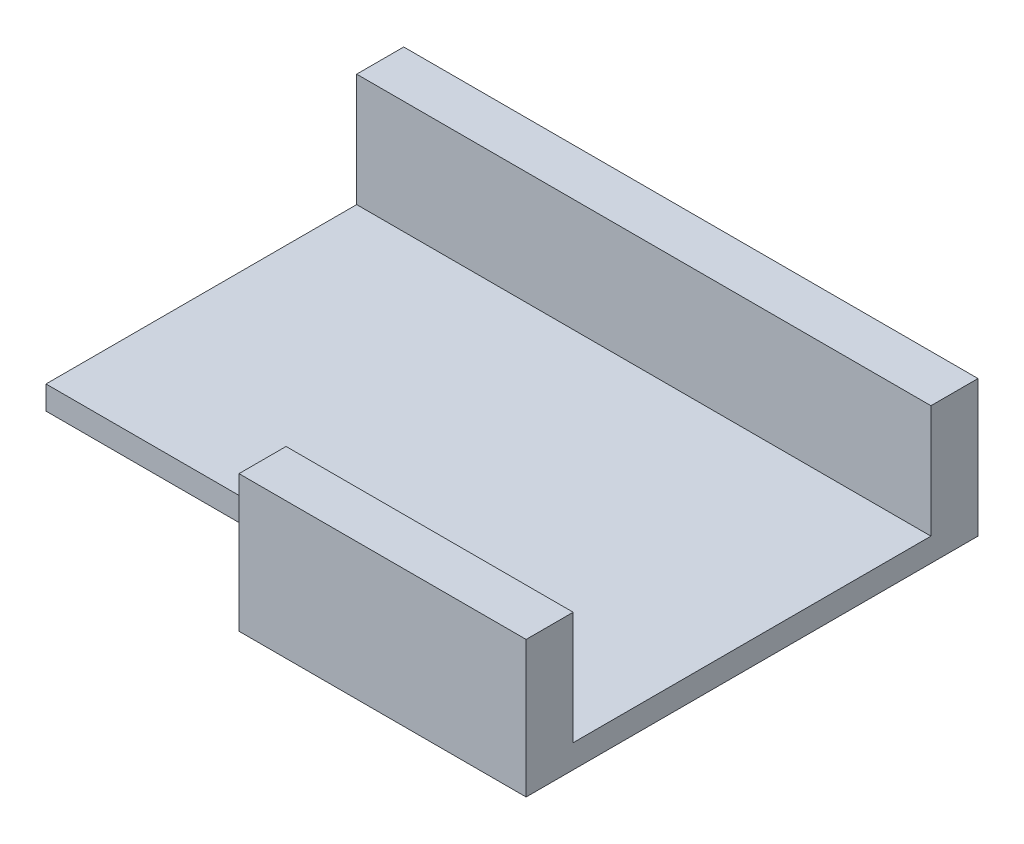
from build123d import *

# Parameters (mm, degrees)
BOSS_EXTRUDE1_DEPTH = 2.5
SKETCH2_W           = 61
SKETCH2_H           = 5
SKETCH2_W_2         = 30.5
BOSS_EXTRUDE2_DEPTH = 12
CUT_EXTRUDE1_DEPTH  = 1


with BuildPart() as part:
    # Sketch1 → Boss-Extrude1 (new body)
    with BuildSketch(Plane(origin=(0, 0, 0), x_dir=(1, 0, 0), z_dir=(0, 1, 0))):
        Polygon((0, 10), (30.5, 10), (30.5, 0), (61, 0), (61, 48), (0, 48), align=None)
    extrude(amount=BOSS_EXTRUDE1_DEPTH)

    # Sketch2 → Boss-Extrude2 (add)
    with BuildSketch(Plane(origin=(0, 2.5, 0), x_dir=(1, 0, 0), z_dir=(0, 1, 0))):
        with Locations((30.5, 45.5)):
            Rectangle(SKETCH2_W, SKETCH2_H)
        with Locations((45.75, 2.5)):
            Rectangle(SKETCH2_W_2, SKETCH2_H)
    extrude(amount=BOSS_EXTRUDE2_DEPTH)

    # Sketch3 → Cut-Extrude1 (cut)
    # profile 1 of 3: a face of its own
    with BuildSketch(Plane.XZ):
        with BuildLine():
            Line((33.86328125, -25.3125), (34.48125, -25.3125))
            Line((34.48125, -25.3125), (34.48125, -24.368457031))
            add(Edge.make_bspline(
                [(34.48125, -24.368457031), (34.48239424, -24.336474597), (34.484546237, -24.276324517), (34.501338872, -24.191750417), (34.530467184, -24.119462511), (34.571596484, -24.060118613), (34.6213594, -24.013525282), (34.678121744, -23.980203479), (34.74130099, -23.960090646), (34.785300335, -23.957557383), (34.808007812, -23.95625)],
                knots=[0, 0, 0, 0, 1.295934932, 2.437293871, 3.476884157, 4.432697822, 5.341229782, 6.218948562, 7.080823006, 8, 8, 8, 8], degree=3))
            add(Edge.make_bspline(
                [(34.808007812, -23.95625), (34.8316052, -23.95759305), (34.877349561, -23.9601966), (34.942644764, -23.979576761), (35.000045694, -24.013396419), (35.049241996, -24.060167447), (35.089336549, -24.11922265), (35.118192016, -24.190865316), (35.134945088, -24.27449113), (35.136617117, -24.334196437), (35.1375, -24.365722656)],
                knots=[0, 0, 0, 0, 0.953503961, 1.84840077, 2.723875908, 3.623362083, 4.571508737, 5.587892323, 6.726333698, 8, 8, 8, 8], degree=3))
            Line((35.1375, -24.365722656), (35.1375, -26.952441406))
            add(Edge.make_bspline(
                [(35.1375, -26.952441406), (35.137309541, -26.970453538), (35.136942339, -27.005180782), (35.132109907, -27.05547116), (35.123988289, -27.101610656), (35.113173049, -27.144056975), (35.09877644, -27.182238074), (35.081834065, -27.216903852), (35.061176018, -27.247343286), (35.028696375, -27.282553112), (34.977342302, -27.318587605), (34.90253473, -27.348308313), (34.813122341, -27.365734265), (34.748847605, -27.367696821), (34.714355469, -27.36875)],
                knots=[0, 0, 0, 0, 0.941432114, 1.815073475, 2.637677653, 3.388955501, 4.101451217, 4.767410686, 5.401829277, 6.017285369, 7.263665478, 8.641928091, 10.197937795, 12, 12, 12, 12], degree=3))
            Line((34.714355469, -27.36875), (33.857128906, -27.36875))
            add(Edge.make_bspline(
                [(33.857128906, -27.36875), (33.826361754, -27.368765475), (33.766629061, -27.368795519), (33.679818936, -27.364836196), (33.598400099, -27.360544309), (33.522550046, -27.353342107), (33.451939103, -27.345835288), (33.387096157, -27.334392967), (33.3273701, -27.322705191), (33.289918952, -27.312240947), (33.271972656, -27.307226563)],
                knots=[0, 0, 0, 0, 1.25093483, 2.428619552, 3.533171233, 4.56585484, 5.526700924, 6.419361569, 7.242570462, 8, 8, 8, 8], degree=3))
            add(Edge.make_bspline(
                [(33.271972656, -27.307226563), (33.237951469, -27.296865789), (33.171024079, -27.276483796), (33.076914962, -27.232416707), (32.989275965, -27.18045676), (32.909134146, -27.118770913), (32.837200637, -27.048384605), (32.774807455, -26.969771375), (32.720851198, -26.884199515), (32.676366012, -26.79113524), (32.64250918, -26.690930503), (32.617939843, -26.584937391), (32.60239908, -26.473018359), (32.600811741, -26.396276061), (32.6, -26.35703125)],
                knots=[0, 0, 0, 0, 1.01587007, 1.998446821, 2.962857435, 3.924711095, 4.883137489, 5.833623106, 6.788187457, 7.770396829, 8.775995668, 9.806534978, 10.878296272, 12, 12, 12, 12], degree=3))
            add(Edge.make_bspline(
                [(32.6, -26.35703125), (32.600791799, -26.315506736), (32.602333117, -26.234674931), (32.617942425, -26.117336922), (32.641867405, -26.007400691), (32.677187754, -25.905532425), (32.721346607, -25.811053934), (32.776760451, -25.725041415), (32.841427224, -25.646296575), (32.916403464, -25.575701504), (33.001275199, -25.513035101), (33.096032569, -25.458911664), (33.200911882, -25.41419895), (33.314623829, -25.376215077), (33.438393876, -25.348264044), (33.57121392, -25.326836823), (33.714032561, -25.314722174), (33.812445199, -25.313256902), (33.86328125, -25.3125)],
                knots=[0, 0, 0, 0, 1.064099757, 2.071381358, 3.029532051, 3.944102834, 4.830028396, 5.697085954, 6.560336241, 7.436498814, 8.330402393, 9.259414661, 10.22755928, 11.249241442, 12.329118529, 13.476919915, 14.696677257, 16, 16, 16, 16], degree=3))
        make_face()
        with BuildLine():
            Line((34.026660156, -26.84375), (34.48125, -26.84375))
            Line((34.48125, -26.84375), (34.48125, -25.8375))
            Line((34.48125, -25.8375), (34.026660156, -25.8375))
            add(Edge.make_bspline(
                [(34.026660156, -25.8375), (33.988592541, -25.838237268), (33.915538617, -25.839652128), (33.81060953, -25.848082671), (33.71549599, -25.863665996), (33.629922403, -25.885202249), (33.553847729, -25.913659606), (33.487054747, -25.950165269), (33.429663459, -25.994661369), (33.382279686, -26.047723655), (33.34445944, -26.108769705), (33.318824349, -26.179264403), (33.302885742, -26.258110004), (33.300990332, -26.313654404), (33.3, -26.342675781)],
                knots=[0, 0, 0, 0, 1.355490531, 2.601263584, 3.744314843, 4.783295291, 5.73857318, 6.628241228, 7.483545512, 8.310919991, 9.148572807, 10.024070886, 10.967597354, 12, 12, 12, 12], degree=3))
            add(Edge.make_bspline(
                [(33.3, -26.342675781), (33.301471852, -26.377478655), (33.304308668, -26.444556967), (33.3290638, -26.540041113), (33.368791809, -26.626502831), (33.409112888, -26.673866349), (33.429199219, -26.697460938)],
                knots=[0, 0, 0, 0, 1.078100798, 2.07790835, 3.042491687, 4, 4, 4, 4], degree=3))
            add(Edge.make_bspline(
                [(33.429199219, -26.697460938), (33.442509491, -26.70933628), (33.470638515, -26.734432821), (33.522606761, -26.763805357), (33.583688523, -26.788247214), (33.653818972, -26.808474028), (33.733550852, -26.82486366), (33.822913711, -26.835983762), (33.921732586, -26.842879876), (33.990644933, -26.84345134), (34.026660156, -26.84375)],
                knots=[0, 0, 0, 0, 0.679605585, 1.436232247, 2.263557416, 3.188698774, 4.219445133, 5.368894214, 6.624921853, 8, 8, 8, 8], degree=3))
        make_face(mode=Mode.SUBTRACT)
    # profile 2 of 3: a face of its own
    with BuildSketch(Plane.XZ):
        with BuildLine():
            add(Edge.make_bspline(
                [(29.141699219, -25.072558594), (29.142627548, -25.045377271), (29.144544291, -24.989255328), (29.160670802, -24.90388712), (29.185350326, -24.815056444), (29.220514712, -24.72384793), (29.264937159, -24.630532028), (29.323530716, -24.539258737), (29.391376403, -24.447534585), (29.470933455, -24.357832979), (29.562161785, -24.272156868), (29.666223271, -24.194806178), (29.78159185, -24.125611324), (29.908424046, -24.065365503), (30.046627258, -24.015600369), (30.196962897, -23.981434929), (30.357857993, -23.959697787), (30.468936671, -23.957419778), (30.525976562, -23.95625)],
                knots=[0, 0, 0, 0, 0.663809421, 1.370583582, 2.116381689, 2.914792191, 3.756591336, 4.637276302, 5.560556971, 6.542796295, 7.563249714, 8.61348911, 9.705063432, 10.845866508, 12.040043321, 13.286776638, 14.606735603, 16, 16, 16, 16], degree=3))
            add(Edge.make_bspline(
                [(30.525976562, -23.95625), (30.56952206, -23.956607885), (30.654674631, -23.957307723), (30.77941016, -23.96766795), (30.898262463, -23.981815887), (31.011191593, -24.004152866), (31.118552239, -24.03200962), (31.221180036, -24.066016617), (31.318446263, -24.107945169), (31.411113288, -24.156806069), (31.500320124, -24.212305732), (31.584677459, -24.276934617), (31.666369128, -24.348844824), (31.716113809, -24.402632424), (31.74140625, -24.429980469)],
                knots=[0, 0, 0, 0, 1.162630074, 2.273505771, 3.340854002, 4.357736274, 5.345239217, 6.30170676, 7.242243125, 8.17051209, 9.097503438, 10.04445617, 11.005713226, 12, 12, 12, 12], degree=3))
            add(Edge.make_bspline(
                [(31.74140625, -24.429980469), (31.763382854, -24.457299605), (31.807431964, -24.512057093), (31.867906767, -24.599273348), (31.922446365, -24.691828691), (31.971995014, -24.788799108), (32.017641672, -24.889292284), (32.05620932, -24.993814225), (32.08943495, -25.101688094), (32.115589681, -25.213022396), (32.137211634, -25.327687277), (32.15190493, -25.445718355), (32.161157304, -25.567330415), (32.162047851, -25.64949452), (32.1625, -25.691210937)],
                knots=[0, 0, 0, 0, 0.929585709, 1.863227982, 2.811461118, 3.776261533, 4.749952569, 5.736551839, 6.728594992, 7.741346452, 8.767706922, 9.821503149, 10.893932021, 12, 12, 12, 12], degree=3))
            add(Edge.make_bspline(
                [(32.1625, -25.691210937), (32.16115634, -25.758047093), (32.158534311, -25.888471667), (32.135218348, -26.078448129), (32.099087507, -26.258119476), (32.0461427, -26.42645083), (31.979788468, -26.583749333), (31.900253243, -26.729540045), (31.807554025, -26.863680201), (31.702143677, -26.985419612), (31.585625789, -27.094320397), (31.459427375, -27.190118375), (31.322982336, -27.270697352), (31.179013685, -27.33866888), (31.027654415, -27.391119315), (30.870852127, -27.428799727), (30.709190508, -27.451996642), (30.599652983, -27.454824458), (30.544433594, -27.45625)],
                knots=[0, 0, 0, 0, 1.192073534, 2.326221231, 3.409828448, 4.457827128, 5.468939524, 6.451447323, 7.415699984, 8.372639448, 9.31899229, 10.256535946, 11.193647551, 12.141230983, 13.092713807, 14.046270366, 15.015097733, 16, 16, 16, 16], degree=3))
            add(Edge.make_bspline(
                [(30.544433594, -27.45625), (30.510693283, -27.455700013), (30.444040937, -27.45461354), (30.345504951, -27.446728549), (30.249463222, -27.435105119), (30.156618408, -27.415853856), (30.066148785, -27.394045563), (29.978975009, -27.365331623), (29.894167976, -27.333082269), (29.812957056, -27.294473043), (29.735632383, -27.252263218), (29.662367864, -27.207841274), (29.593629776, -27.161435398), (29.529905508, -27.111883577), (29.470463566, -27.060391839), (29.416381542, -27.00580611), (29.365977019, -26.949946857), (29.321470352, -26.891168159), (29.281036181, -26.832352073), (29.246990884, -26.773061538), (29.217140932, -26.715133206), (29.193571885, -26.657549126), (29.17359739, -26.601470501), (29.161081685, -26.545646278), (29.152152393, -26.4908458), (29.151104172, -26.454364346), (29.150585937, -26.436328125)],
                knots=[0, 0, 0, 0, 1.284668957, 2.537801117, 3.762584319, 4.965690975, 6.146308853, 7.304293802, 8.458044789, 9.599230559, 10.725239914, 11.81156767, 12.860878232, 13.881416145, 14.883791186, 15.853213571, 16.805831023, 17.746478395, 18.658598637, 19.521777503, 20.34832981, 21.137939278, 21.889792538, 22.611708679, 23.313636733, 24, 24, 24, 24], degree=3))
            add(Edge.make_bspline(
                [(29.150585937, -26.436328125), (29.151719751, -26.417322107), (29.153955539, -26.379843762), (29.169372498, -26.32523942), (29.1961356, -26.274678018), (29.231967064, -26.228837403), (29.275163443, -26.189734067), (29.324402295, -26.16151758), (29.377850323, -26.143019384), (29.415210838, -26.141240079), (29.434277344, -26.140332031)],
                knots=[0, 0, 0, 0, 1.004600132, 1.980990953, 2.972502221, 4.011199951, 5.043730753, 6.031501978, 6.995399868, 8, 8, 8, 8], degree=3))
            add(Edge.make_bspline(
                [(29.434277344, -26.140332031), (29.454841423, -26.14110154), (29.493828505, -26.142560439), (29.548388473, -26.153796071), (29.595128493, -26.17358594), (29.633810582, -26.203600073), (29.668281176, -26.243296222), (29.704172208, -26.292089523), (29.740853872, -26.353239882), (29.76509643, -26.39794629), (29.778125, -26.421972656)],
                knots=[0, 0, 0, 0, 1.036150269, 1.964419307, 2.792539992, 3.57139125, 4.409018128, 5.436022236, 6.622052788, 8, 8, 8, 8], degree=3))
            add(Edge.make_bspline(
                [(29.778125, -26.421972656), (29.800530009, -26.462360578), (29.843753765, -26.54027698), (29.91992911, -26.64489999), (30.002451951, -26.733177846), (30.090685173, -26.806898887), (30.188580799, -26.863538515), (30.296501945, -26.903256396), (30.41492428, -26.92659269), (30.497158871, -26.929663402), (30.539648437, -26.93125)],
                knots=[0, 0, 0, 0, 1.140605131, 2.200456059, 3.188445675, 4.120704386, 5.03149181, 5.968686328, 6.950446063, 8, 8, 8, 8], degree=3))
            add(Edge.make_bspline(
                [(30.539648437, -26.93125), (30.573895871, -26.930489449), (30.641176184, -26.92899532), (30.73900723, -26.912582011), (30.831767288, -26.887429724), (30.919066007, -26.851712223), (31.001074259, -26.805592879), (31.077443162, -26.748776405), (31.148877248, -26.682364452), (31.213781704, -26.605174132), (31.272474153, -26.519099316), (31.323877784, -26.424339484), (31.36727003, -26.320874794), (31.401444813, -26.208705273), (31.428995118, -26.088104374), (31.44853262, -25.959026101), (31.460119382, -25.821306412), (31.461692095, -25.726780675), (31.4625, -25.678222656)],
                knots=[0, 0, 0, 0, 0.936881308, 1.840536965, 2.707859603, 3.564070369, 4.416111086, 5.277127478, 6.16441668, 7.080712987, 8.03249564, 9.012429363, 10.027484651, 11.099028271, 12.21902665, 13.412014178, 14.670547665, 16, 16, 16, 16], degree=3))
            add(Edge.make_bspline(
                [(31.4625, -25.678222656), (31.461989548, -25.645407372), (31.460992931, -25.581338046), (31.456612284, -25.487095932), (31.447310234, -25.397327336), (31.436256789, -25.311415195), (31.420266484, -25.230034481), (31.401430504, -25.152814849), (31.378552673, -25.079869886), (31.353093411, -25.0109099), (31.322970649, -24.946606522), (31.292232911, -24.885471527), (31.25702381, -24.82912788), (31.218868448, -24.77742969), (31.178066839, -24.729594052), (31.134632471, -24.685902225), (31.087776748, -24.646801226), (31.022060624, -24.600199179), (30.933007852, -24.55215441), (30.817353592, -24.510859906), (30.692949763, -24.48562254), (30.606989242, -24.482732579), (30.562890625, -24.48125)],
                knots=[0, 0, 0, 0, 1.161534802, 2.267807614, 3.337466882, 4.354804688, 5.332236354, 6.271079903, 7.1663807, 8.036633147, 8.870242868, 9.678179816, 10.456933165, 11.218245902, 11.950381986, 12.680293945, 13.395853249, 14.107402253, 15.529151474, 16.960201914, 18.440552847, 20, 20, 20, 20], degree=3))
            add(Edge.make_bspline(
                [(30.562890625, -24.48125), (30.538714349, -24.481509738), (30.491148586, -24.482020761), (30.421517875, -24.490018387), (30.354658975, -24.50172813), (30.290363892, -24.516876202), (30.22919963, -24.538439971), (30.171040732, -24.564544351), (30.115314579, -24.594632411), (30.06254573, -24.629445072), (30.013280786, -24.669475474), (29.96674909, -24.713400754), (29.922563473, -24.761018956), (29.883216095, -24.814296929), (29.845974389, -24.871222488), (29.811987342, -24.932692515), (29.780997337, -24.998411395), (29.763682405, -25.044401093), (29.754882812, -25.067773437)],
                knots=[0, 0, 0, 0, 1.080397715, 2.125635207, 3.128968023, 4.114924668, 5.075119383, 6.023730978, 6.962884813, 7.903860587, 8.845828662, 9.79722652, 10.763563614, 11.745722829, 12.754575448, 13.803530454, 14.883735996, 16, 16, 16, 16], degree=3))
            add(Edge.make_bspline(
                [(29.754882812, -25.067773437), (29.747466635, -25.089546299), (29.733139933, -25.131607495), (29.707115198, -25.190271347), (29.678857852, -25.243050297), (29.648193256, -25.28993096), (29.61067247, -25.33011885), (29.561425928, -25.356871548), (29.503143983, -25.372617272), (29.461275137, -25.374429294), (29.4390625, -25.375390625)],
                knots=[0, 0, 0, 0, 1.147958706, 2.217646843, 3.200102865, 4.13413323, 5.011054943, 5.912792199, 6.892675737, 8, 8, 8, 8], degree=3))
            add(Edge.make_bspline(
                [(29.4390625, -25.375390625), (29.419332886, -25.374410119), (29.380524411, -25.372481447), (29.324916776, -25.355010569), (29.273013687, -25.328304442), (29.228143963, -25.289622123), (29.18918267, -25.244352077), (29.161961095, -25.191601711), (29.144442231, -25.133814017), (29.142633712, -25.093427174), (29.141699219, -25.072558594)],
                knots=[0, 0, 0, 0, 1.00016121, 1.967333464, 2.935960373, 3.947121854, 4.958283334, 5.952797668, 6.942175154, 8, 8, 8, 8], degree=3))
        make_face()
    # profile 3 of 3: a face of its own
    with BuildSketch(Plane.XZ):
        with BuildLine():
            Line((27.047851562, -24), (28.074609375, -24))
            add(Edge.make_bspline(
                [(28.074609375, -24), (28.092619307, -24.000193292), (28.127115463, -24.000563523), (28.176986259, -24.005287566), (28.222489392, -24.013876349), (28.264806435, -24.0232752), (28.302471703, -24.038308421), (28.336981017, -24.054704454), (28.366615985, -24.07590531), (28.402199512, -24.10711061), (28.43789531, -24.157857293), (28.467132441, -24.232047325), (28.484403348, -24.320510787), (28.486422907, -24.384325188), (28.4875, -24.418359375)],
                knots=[0, 0, 0, 0, 0.950580241, 1.820737862, 2.639492383, 3.395108307, 4.103277191, 4.775707951, 5.406389217, 6.01974044, 7.268478942, 8.63331131, 10.204441141, 12, 12, 12, 12], degree=3))
            Line((28.4875, -24.418359375), (28.4875, -26.950390625))
            add(Edge.make_bspline(
                [(28.4875, -26.950390625), (28.486558998, -26.985138677), (28.48480955, -27.049739867), (28.466178004, -27.138890661), (28.437067866, -27.21380916), (28.392146654, -27.273131373), (28.333448859, -27.31813134), (28.259548404, -27.347592709), (28.171890139, -27.365890009), (28.108438295, -27.367755452), (28.074609375, -27.36875)],
                knots=[0, 0, 0, 0, 1.222411313, 2.272623094, 3.194004984, 4.030548869, 4.860712291, 5.767285671, 6.809643506, 8, 8, 8, 8], degree=3))
            Line((28.074609375, -27.36875), (26.986328125, -27.36875))
            add(Edge.make_bspline(
                [(26.986328125, -27.36875), (26.947585349, -27.368319683), (26.872794067, -27.367488973), (26.764449292, -27.362179004), (26.664062618, -27.352751354), (26.570816227, -27.339353318), (26.483757921, -27.320429199), (26.402087079, -27.294304896), (26.324736048, -27.261658149), (26.276732658, -27.234120835), (26.252832031, -27.220410156)],
                knots=[0, 0, 0, 0, 1.226472414, 2.367652864, 3.432823769, 4.417264084, 5.348326398, 6.249426703, 7.128399084, 8, 8, 8, 8], degree=3))
            add(Edge.make_bspline(
                [(26.252832031, -27.220410156), (26.233001171, -27.207991726), (26.193341333, -27.183156044), (26.138199561, -27.139847315), (26.086275021, -27.092122739), (26.038027892, -27.039942877), (25.99449209, -26.983335018), (25.956005098, -26.923685886), (25.92311684, -26.861222295), (25.895538206, -26.796162224), (25.874452309, -26.728567398), (25.859612882, -26.658983455), (25.849298031, -26.587710146), (25.848531606, -26.539360077), (25.848144531, -26.514941406)],
                knots=[0, 0, 0, 0, 0.988965275, 1.977836645, 2.959923225, 3.969243347, 4.979253288, 5.976307915, 6.967758444, 7.961080518, 8.960786087, 9.956908888, 10.968159317, 12, 12, 12, 12], degree=3))
            add(Edge.make_bspline(
                [(25.848144531, -26.514941406), (25.849677896, -26.47380023), (25.852669892, -26.393523047), (25.877236474, -26.27761179), (25.916779061, -26.170012163), (25.974023454, -26.071790142), (26.046759809, -25.981775196), (26.136051212, -25.901011052), (26.240801946, -25.828411484), (26.319031488, -25.789789865), (26.359472656, -25.769824219)],
                knots=[0, 0, 0, 0, 1.026554463, 2.003075956, 2.944823764, 3.877918586, 4.828836702, 5.82368928, 6.874944855, 8, 8, 8, 8], degree=3))
            add(Edge.make_bspline(
                [(26.359472656, -25.769824219), (26.332242876, -25.760795208), (26.279100881, -25.743174071), (26.202997671, -25.712048177), (26.131698711, -25.678905144), (26.065795822, -25.641999784), (26.005570372, -25.601322878), (25.94977231, -25.558507167), (25.899872457, -25.511843564), (25.85498453, -25.462263062), (25.815372861, -25.409670704), (25.780730166, -25.353977305), (25.752385609, -25.294846845), (25.727711579, -25.23322519), (25.710732308, -25.167598829), (25.696410179, -25.099524514), (25.689272655, -25.028048017), (25.688097322, -24.979601645), (25.6875, -24.954980469)],
                knots=[0, 0, 0, 0, 1.203679095, 2.349115882, 3.448557464, 4.501905559, 5.515114208, 6.496455107, 7.450530545, 8.378166232, 9.30006595, 10.210385309, 11.125664208, 12.049149821, 12.991069707, 13.966334133, 14.966460368, 16, 16, 16, 16], degree=3))
            add(Edge.make_bspline(
                [(25.6875, -24.954980469), (25.689014195, -24.909472221), (25.692004234, -24.819608312), (25.721588478, -24.689042685), (25.766459222, -24.564676685), (25.831123737, -24.449596172), (25.910864872, -24.345174094), (26.003982969, -24.253812638), (26.110436408, -24.177104902), (26.189508086, -24.139416769), (26.229589844, -24.1203125)],
                knots=[0, 0, 0, 0, 1.033834717, 2.041485486, 3.030507847, 4.033024739, 5.031525878, 6.010332711, 6.991429506, 8, 8, 8, 8], degree=3))
            add(Edge.make_bspline(
                [(26.229589844, -24.1203125), (26.256106047, -24.109661266), (26.310258048, -24.087909071), (26.396010486, -24.06219119), (26.487213739, -24.04179967), (26.584541478, -24.026410604), (26.688722743, -24.013826397), (26.801221224, -24.006349052), (26.921777406, -24.000312546), (27.005004133, -24.000106222), (27.047851562, -24)],
                knots=[0, 0, 0, 0, 0.823420075, 1.681607438, 2.577190951, 3.515615972, 4.521031721, 5.60117513, 6.765018365, 8, 8, 8, 8], degree=3))
        make_face()
        with BuildLine():
            Line((27.111425781, -25.4875), (27.83125, -25.4875))
            Line((27.83125, -25.4875), (27.83125, -24.525))
            Line((27.83125, -24.525), (27.088183594, -24.525))
            add(Edge.make_bspline(
                [(27.088183594, -24.525), (27.059920113, -24.52543168), (27.005161551, -24.52626803), (26.925723081, -24.531605741), (26.851710225, -24.540971529), (26.783029775, -24.554791296), (26.719706283, -24.571643034), (26.661405387, -24.591749515), (26.609737746, -24.617574538), (26.562208764, -24.645204724), (26.521266074, -24.678397652), (26.485380828, -24.714775499), (26.45455926, -24.754944299), (26.430416706, -24.799453433), (26.410640972, -24.847475379), (26.397402547, -24.899485431), (26.388949271, -24.9551597), (26.387991093, -24.993457324), (26.3875, -25.013085938)],
                knots=[0, 0, 0, 0, 1.397742627, 2.708030754, 3.935246177, 5.084444886, 6.169650434, 7.174788793, 8.127320797, 9.022110557, 9.887978447, 10.724683624, 11.545066137, 12.382378172, 13.221508147, 14.107096923, 15.029833744, 16, 16, 16, 16], degree=3))
            add(Edge.make_bspline(
                [(26.3875, -25.013085938), (26.387901733, -25.033182259), (26.388682092, -25.072219011), (26.398240739, -25.128453327), (26.411231485, -25.18084237), (26.431350153, -25.228761928), (26.457699347, -25.271833723), (26.488631489, -25.311611055), (26.525844229, -25.346470032), (26.568888395, -25.377006792), (26.617899777, -25.402294919), (26.671421989, -25.426233329), (26.731409262, -25.444912207), (26.796762783, -25.460451296), (26.86754507, -25.472658311), (26.943739232, -25.481689054), (27.025699279, -25.486012046), (27.082255557, -25.486993693), (27.111425781, -25.4875)],
                knots=[0, 0, 0, 0, 0.977880629, 1.899515975, 2.771901852, 3.602759334, 4.419480849, 5.225647902, 6.050177927, 6.894132172, 7.78807547, 8.732623977, 9.747180444, 10.843017304, 12.003729791, 13.244342432, 14.578705085, 16, 16, 16, 16], degree=3))
        make_face(mode=Mode.SUBTRACT)
        with BuildLine():
            Line((27.83125, -26.84375), (27.83125, -25.96875))
            Line((27.83125, -25.96875), (27.197558594, -25.96875))
            add(Edge.make_bspline(
                [(27.197558594, -25.96875), (27.156973388, -25.969065899), (27.080458148, -25.969661462), (26.973143678, -25.979437946), (26.88014618, -25.993769857), (26.800363651, -26.014557929), (26.731170496, -26.044190238), (26.672557983, -26.086049302), (26.621602717, -26.138486857), (26.596127093, -26.180315046), (26.583007812, -26.201855469)],
                knots=[0, 0, 0, 0, 1.403188877, 2.645430288, 3.723412984, 4.65448343, 5.490696833, 6.310671537, 7.130040031, 8, 8, 8, 8], degree=3))
            add(Edge.make_bspline(
                [(26.583007812, -26.201855469), (26.573811959, -26.218244998), (26.555498655, -26.250884319), (26.537481768, -26.304598002), (26.525032014, -26.360783857), (26.524038789, -26.399570708), (26.523535156, -26.419238281)],
                knots=[0, 0, 0, 0, 0.986246372, 1.964084069, 2.967652058, 4, 4, 4, 4], degree=3))
            add(Edge.make_bspline(
                [(26.523535156, -26.419238281), (26.52392897, -26.439786882), (26.524681399, -26.47904742), (26.533972424, -26.535207), (26.548011144, -26.586066395), (26.56799198, -26.632045422), (26.593885063, -26.672627222), (26.626214766, -26.707572928), (26.66406236, -26.737135025), (26.70812837, -26.761191323), (26.75795361, -26.780704316), (26.813307806, -26.797607683), (26.874720597, -26.812087923), (26.942163816, -26.8231071), (27.015493706, -26.833202985), (27.094734705, -26.838588972), (27.179960851, -26.843132991), (27.238794476, -26.843539154), (27.269335937, -26.84375)],
                knots=[0, 0, 0, 0, 1.002487167, 1.91537062, 2.771340706, 3.573543484, 4.35447135, 5.110504264, 5.887378225, 6.689349431, 7.553095987, 8.496399407, 9.513966103, 10.631738514, 11.83255751, 13.12725712, 14.508713903, 16, 16, 16, 16], degree=3))
            Line((27.269335937, -26.84375), (27.83125, -26.84375))
        make_face(mode=Mode.SUBTRACT)
    extrude(amount=-CUT_EXTRUDE1_DEPTH, mode=Mode.SUBTRACT)


solid = part.part
